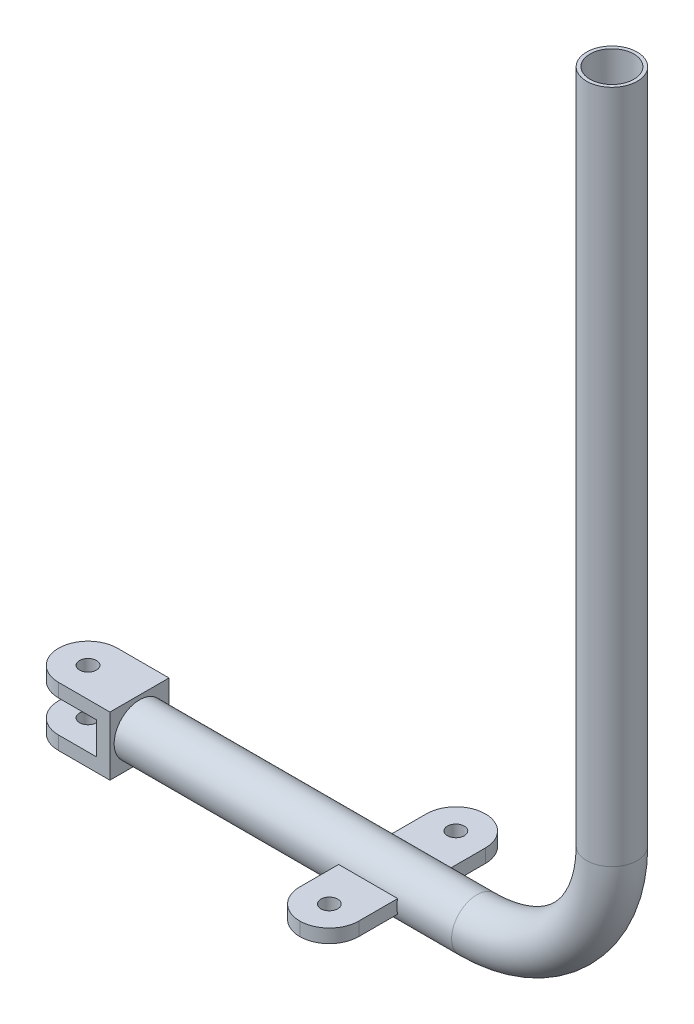
from build123d import *

# Parameters (mm, degrees)
SWEEP_THIN3_PROFILE_R   = 15
SWEEP_THIN3_PROFILE_R_2 = 13
SKETCH57_W              = 35
SKETCH57_H              = 35
BOSS_EXTRUDE1_DEPTH     = 8
SKETCH58_W              = 35
SKETCH58_H              = 8
BOSS_EXTRUDE2_DEPTH     = 40
FILLET1_R               = 17.5
SKETCH59_R              = 5
CUT_EXTRUDE1_DEPTH      = 549.85107275
SKETCH60_W              = 35
SKETCH60_H              = 8
BOSS_EXTRUDE3_DEPTH     = 55
FILLET2_R               = 17.5
SKETCH61_R              = 5
CUT_EXTRUDE2_DEPTH      = 55
FILLET2_OF_MIRROR1_R    = 17.5


with BuildPart() as part:
    # Sweep-Thin3: sweep along a path in Sketch44
    with BuildLine(Plane.XY) as sweep_thin3_path:
        Line((0, 0), (200, 0))
        ThreePointArc((200, 0), (256.568542495, 23.431457505), (280, 80))
        Line((280, 80), (280, 480))
    # Sweep-Thin3 profile (on start of the path) → Sweep-Thin3 (sweep)
    with BuildSketch(Plane(origin=(0, 0, 0), x_dir=(0, 0, 1), z_dir=(1, 0, 0))):
        Circle(SWEEP_THIN3_PROFILE_R)
        Circle(SWEEP_THIN3_PROFILE_R_2, mode=Mode.SUBTRACT)
    sweep(path=sweep_thin3_path.line)

    # Sketch57 → Boss-Extrude1 (add)
    with BuildSketch(Plane.ZY):
        Rectangle(SKETCH57_W, SKETCH57_H)
    extrude(amount=BOSS_EXTRUDE1_DEPTH)

    # Sketch58 → Boss-Extrude2 (add)
    with BuildSketch(Plane.ZY.offset(8)):
        with Locations((0, 13.5)):
            Rectangle(SKETCH58_W, SKETCH58_H)
        with Locations((0, -13.5)):
            Rectangle(SKETCH58_W, SKETCH58_H)
    extrude(amount=BOSS_EXTRUDE2_DEPTH)

    # Fillet1
    fillet1_edges = [part.edges().sort_by_distance(p)[0] for p in [
        (-48, -13.5, 17.5),
        (-48, -13.5, -17.5),
        (-48, 13.5, 17.5),
        (-48, 13.5, -17.5),
    ]]
    fillet(fillet1_edges, radius=FILLET1_R - 0.0001)  # a hair under: the kernel refuses the full size

    # Sketch59 → Cut-Extrude1 (cut, through all)
    with BuildSketch(Plane(origin=(0, 17.5, 0), x_dir=(1, 0, 0), z_dir=(0, 1, 0))):
        with Locations(Location((-30.5, 0, 0), (0, 0, 270))):
            Circle(SKETCH59_R)
    extrude(amount=-CUT_EXTRUDE1_DEPTH, mode=Mode.SUBTRACT)

    # Sketch60 → Boss-Extrude3 (add)
    with BuildSketch(Plane.XY):
        with Locations((150, 0)):
            Rectangle(SKETCH60_W, SKETCH60_H)
    boss_extrude3 = extrude(amount=BOSS_EXTRUDE3_DEPTH)

    # Fillet2
    fillet2_edges = [part.edges().sort_by_distance(p)[0] for p in [
        (132.5, 0, 55),
        (167.5, 0, 55),
    ]]
    fillet(fillet2_edges, radius=FILLET2_R - 0.0001)  # a hair under: the kernel refuses the full size

    # Sketch61 → Cut-Extrude2 (cut)
    with BuildSketch(Plane(origin=(0, 4, 0), x_dir=(1, 0, 0), z_dir=(0, 1, 0))):
        with Locations(Location((150, -37.5, 0), (0, 0, 180))):
            Circle(SKETCH61_R)
    cut_extrude2 = extrude(amount=-CUT_EXTRUDE2_DEPTH, mode=Mode.SUBTRACT)

    # Mirror1: Boss-Extrude3, Cut-Extrude2 across plane
    add(boss_extrude3.mirror(Plane.XY))
    add(cut_extrude2.mirror(Plane.XY), mode=Mode.SUBTRACT)

    # Fillet2 of Mirror1
    fillet2_of_mirror1_edges = [part.edges().sort_by_distance(p)[0] for p in [
        (132.5, 0, -55),
        (167.5, 0, -55),
    ]]
    fillet(fillet2_of_mirror1_edges, radius=FILLET2_OF_MIRROR1_R - 0.0001)  # a hair under: the kernel refuses the full size


solid = part.part
